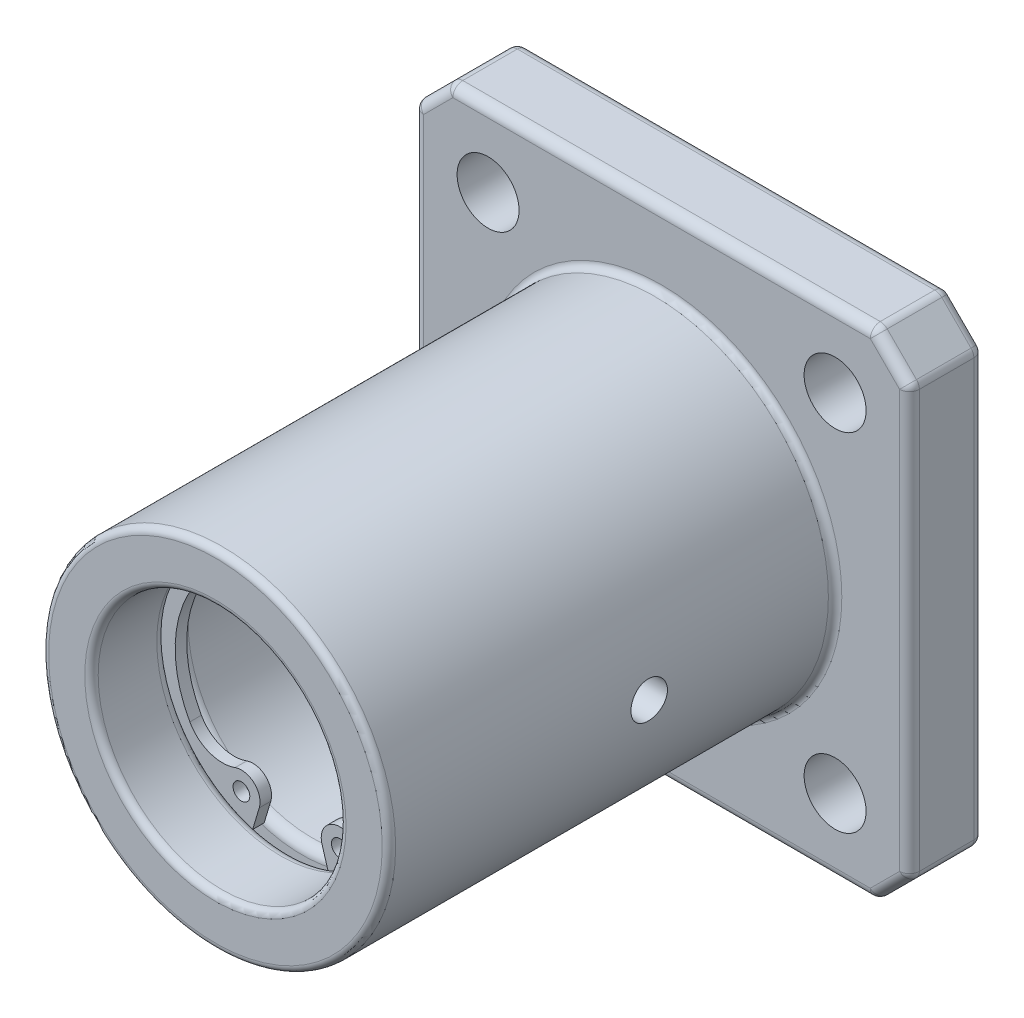
from build123d import *

# Parameters (mm, degrees)
SKETCH1_R                 = 1.984375
BASE_DEPTH                = 4.7625
SKETCH2_R                 = 11.1125
TUBE_DEPTH                = 33.3375
SKETCH3_R                 = 7.9375
ID_CUT_DEPTH              = 41.192289761
FILLET1_R                 = 0.43016143
FILLET2_R                 = 0.635
SKETCH4_W                 = 0.739877473
SKETCH4_H                 = 9.348611129
FILLET7_R                 = 0.635
SKETCH7_R                 = 0.53578125
BOSS_EXTRUDE1_DEPTH       = 0.739877
SKETCH_PATTERN1_START     = 4.816372527
SKETCH_PATTERN1_OUTLINE_R = 0.53578125
SKETCH_PATTERN1_DEPTH     = 0.739877473
SKETCH6_R                 = 1.1684
ZERK_HOLE_DEPTH           = 41.192289761


# Read off the part's stored shape, not the designer's step: Sketch-Pattern1
with BuildPart() as part:
    # Sketch1 → Base (new body)
    with BuildSketch(Plane.XY):
        Polygon((-13.62993597, 15.875), (-15.875, 13.62993597), (-15.875, -13.62993597), (-13.62993597, -15.875), (13.62993597, -15.875), (15.875, -13.62993597), (15.875, 13.62993597), (13.62993597, 15.875), align=None)
        with Locations((-11.1125, 11.1125)):
            Circle(SKETCH1_R, mode=Mode.SUBTRACT)
        with Locations((-11.1125, -11.1125)):
            Circle(SKETCH1_R, mode=Mode.SUBTRACT)
        with Locations((11.1125, -11.1125)):
            Circle(SKETCH1_R, mode=Mode.SUBTRACT)
        with Locations((11.1125, 11.1125)):
            Circle(SKETCH1_R, mode=Mode.SUBTRACT)
    extrude(amount=BASE_DEPTH)

    # Sketch2 → Tube (add)
    with BuildSketch(Plane.XY):
        Circle(SKETCH2_R)
    extrude(amount=TUBE_DEPTH)

    # Sketch3 → ID Cut (cut, through all)
    with BuildSketch(Plane.XY.offset(33.3375)):
        Circle(SKETCH3_R)
    extrude(amount=-ID_CUT_DEPTH, mode=Mode.SUBTRACT)

    # Fillet1
    fillet1_edges = [part.edges().sort_by_distance(p)[0] for p in [
        (-11.1125, 0, 4.7625),
        (-11.1125, 0, 33.3375),
        (-7.9375, 0, 0),
        (-7.9375, 0, 33.3375),
    ]]
    fillet(fillet1_edges, radius=FILLET1_R)

    # Fillet2
    fillet2_edges = [part.edges().sort_by_distance(p)[0] for p in [
        (-15.875, 0, 4.7625),
        (-14.752467985, 14.752467985, 0),
        (0, 15.875, 0),
        (-14.752467985, -14.752467985, 4.7625),
        (13.62993597, 15.875, 2.38125),
        (15.875, 13.62993597, 2.38125),
        (15.875, -13.62993597, 2.38125),
        (13.62993597, -15.875, 2.38125),
        (-13.62993597, -15.875, 2.38125),
        (-15.875, -13.62993597, 2.38125),
        (-15.875, 13.62993597, 2.38125),
        (-13.62993597, 15.875, 2.38125),
        (0, -15.875, 4.7625),
        (14.752467985, -14.752467985, 4.7625),
        (15.875, 0, 4.7625),
        (14.752467985, 14.752467985, 4.7625),
        (0, 15.875, 4.7625),
        (-14.752467985, 14.752467985, 4.7625),
        (14.752467985, 14.752467985, 0),
        (15.875, 0, 0),
        (14.752467985, -14.752467985, 0),
        (0, -15.875, 0),
        (-14.752467985, -14.752467985, 0),
        (-15.875, 0, 0),
    ]]
    fillet(fillet2_edges, radius=FILLET2_R)

    # Sketch4 → Retaining Ring Cut (revolve, cut)
    with BuildSketch(Plane(origin=(0, 0, 0), x_dir=(0, 0, -1), z_dir=(1, 0, 0)), mode=Mode.PRIVATE) as retaining_ring_cut_sk:
        with Locations((-28.151188737, 4.674305565)):
            Rectangle(SKETCH4_W, SKETCH4_H)
        with Locations((-5.186311264, 4.674305565)):
            Rectangle(SKETCH4_W, SKETCH4_H)
    revolve(retaining_ring_cut_sk.sketch.rotate(Axis((0, 0, 0), (0, 0, 1)), 270), axis=Axis((0, 0, 0), (0, 0, 1)), mode=Mode.SUBTRACT)

    # Fillet7
    fillet7_edges = [part.edges().sort_by_distance(p)[0] for p in [
        (-7.9375, 0, 28.521127473),
        (-7.9375, 0, 27.78125),
        (-7.9375, 0, 5.55625),
        (-7.9375, 0, 4.816372527),
    ]]
    fillet(fillet7_edges, radius=FILLET7_R)

    # Sketch6 → Zerk Hole (cut, through all)
    with BuildSketch(Plane(origin=(0, 0, 0), x_dir=(0, 0, -1), z_dir=(1, 0, 0))):
        with Locations(Location((-16.66875, 0, 0), (0, 0, 180))):
            Circle(SKETCH6_R)
    extrude(amount=ZERK_HOLE_DEPTH, mode=Mode.SUBTRACT)


with BuildPart() as body_2:
    # Sketch7 → Boss-Extrude1 (new body)
    with BuildSketch(Plane.XY.offset(27.78125)):
        with BuildLine():
            Line((2.009785492, -6.593356051), (2.43443125, -8.00446718))
            ThreePointArc((2.43443125, -8.00446718), (0, 8.366477774), (-2.43443125, -8.00446718))
            Line((-2.43443125, -8.00446718), (-2.009785492, -6.593356051))
            ThreePointArc((-2.009785492, -6.593356051), (-2.330904854, -5.386068588), (-3.553683685, -5.13019246))
            ThreePointArc((-3.553683685, -5.13019246), (-5.203637624, -5.120564893), (-6.455467083, -4.045686438))
            ThreePointArc((-6.455467083, -4.045686438), (0, 6.955366646), (6.455467083, -4.045686438))
            ThreePointArc((6.455467083, -4.045686438), (5.203637624, -5.120564893), (3.553683685, -5.13019246))
            ThreePointArc((3.553683685, -5.13019246), (2.330904854, -5.386068588), (2.009785492, -6.593356051))
        make_face()
        with Locations((-3.14990515, -6.250259773)):
            Circle(SKETCH7_R, mode=Mode.SUBTRACT)
        with Locations((3.14990515, -6.250259773)):
            Circle(SKETCH7_R, mode=Mode.SUBTRACT)
    extrude(amount=BOSS_EXTRUDE1_DEPTH)


with BuildPart() as body_3:
    # Sketch-Pattern1 outline → Sketch-Pattern1 (new body)
    with BuildSketch(Plane.XY.offset(SKETCH_PATTERN1_START)):
        with BuildLine():
            ThreePointArc((2.43443125, -8.00446718), (0, 8.366477774), (-2.43443125, -8.00446718))
            Line((-2.43443125, -8.00446718), (-2.009785492, -6.593356051))
            ThreePointArc((-2.009785492, -6.593356051), (-2.330904854, -5.386068588), (-3.553683685, -5.13019246))
            ThreePointArc((-3.553683685, -5.13019246), (-5.203637623, -5.120564893), (-6.455467083, -4.045686438))
            ThreePointArc((-6.455467083, -4.045686438), (0, 6.955366646), (6.455467083, -4.045686438))
            ThreePointArc((6.455467083, -4.045686438), (5.203637623, -5.120564893), (3.553683685, -5.13019246))
            ThreePointArc((3.553683685, -5.13019246), (2.330904854, -5.386068588), (2.009785492, -6.593356051))
            Line((2.009785492, -6.593356051), (2.43443125, -8.00446718))
        make_face()
        with Locations((-3.14990515, -6.250259773)):
            Circle(SKETCH_PATTERN1_OUTLINE_R, mode=Mode.SUBTRACT)
        with Locations((3.14990515, -6.250259773)):
            Circle(SKETCH_PATTERN1_OUTLINE_R, mode=Mode.SUBTRACT)
    extrude(amount=SKETCH_PATTERN1_DEPTH)


solid = Compound([part.part, body_2.part, body_3.part])
